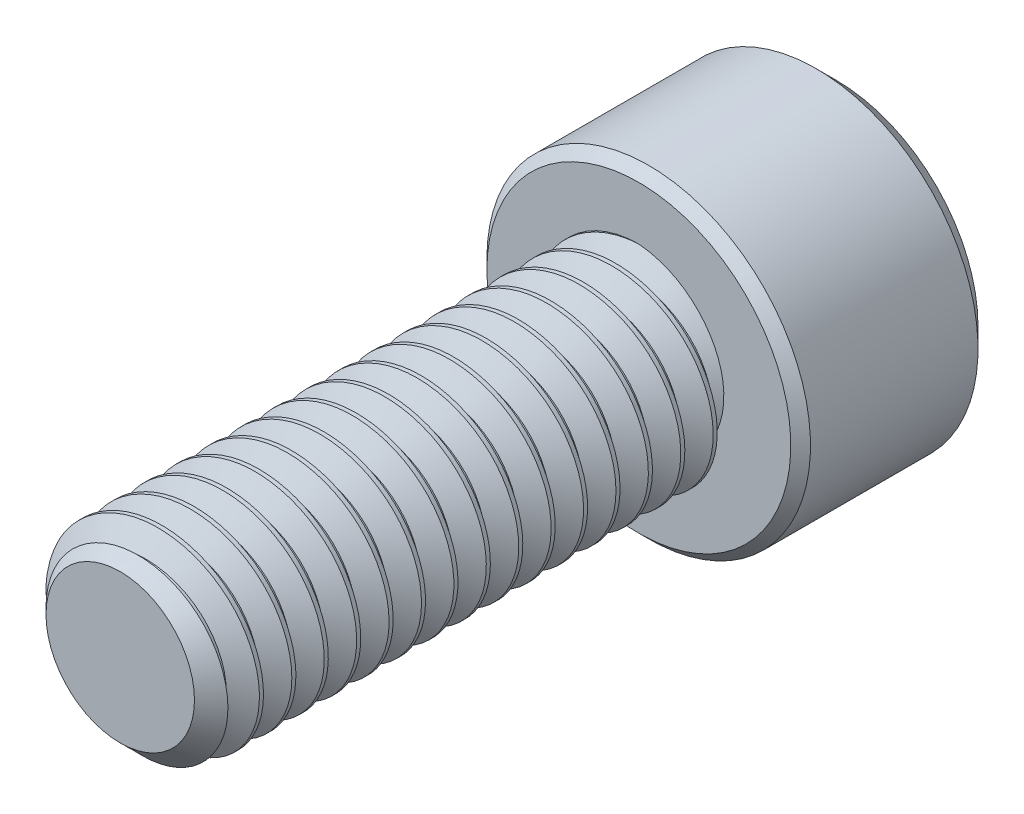
from build123d import *

# Parameters (mm, degrees)
SKETCH1_R          = 2.413
EXTRUDE1_DEPTH     = 12.7
CHAMFER3_SIZE      = 0.5953125
CUT_SWEEP1_PITCH   = 0.79375
SKETCH6_R          = 3.9624
EXTRUDE2_DEPTH     = 4.826
CUT_EXTRUDE1_DEPTH = 2.9765625
SKETCH8_R          = 2.291358881
CUT_EXTRUDE2_DEPTH = 0.4826
CUT_EXTRUDE2_DRAFT = -45
CHAMFER1_SIZE      = 0.4826
CHAMFER2_SIZE      = 0.2413


with BuildPart() as part:
    # Sketch1 → Extrude1 (new body)
    with BuildSketch(Plane.XY):
        Circle(SKETCH1_R)
    extrude(amount=-EXTRUDE1_DEPTH)

    # Chamfer3
    chamfer3_edges = [part.edges().sort_by_distance(p)[0] for p in [
        (-2.413, 0, 0),
    ]]
    chamfer(chamfer3_edges, length=CHAMFER3_SIZE)

    # Cut-Sweep1: the profile of Sketch3 profile screwed along a right-hand helix of 17 turns, 6 arcs to a turn; built about Z, then put on its axis
    cut_sweep1_z = Axis((0, 0, 0), (0, 0, 1))
    cut_sweep1_corners = [(2.4133, 0, -0.694704455), (1.897444252, 0, -0.396875), (1.897444252, 0, -0.29765625), (2.4133, 0, 0.000173205)]
    with BuildLine(mode=Mode.PRIVATE) as cut_sweep1_profile:
        Line(cut_sweep1_corners[0], cut_sweep1_corners[1])
        Line(cut_sweep1_corners[1], cut_sweep1_corners[2])
        Line(cut_sweep1_corners[2], cut_sweep1_corners[3])
        Line(cut_sweep1_corners[3], cut_sweep1_corners[0])
    cut_sweep1_cap = Face(cut_sweep1_profile.wire())
    cut_sweep1_turn_angles = [0, 30, 60, 90, 120, 150, 180, 210, 240, 270, 300, 330, 360]
    cut_sweep1_turn_weights = [1, 0.8660254037844387, 1, 0.8660254037844387, 1, 0.8660254037844387, 1, 0.8660254037844387, 1, 0.8660254037844387, 1, 0.8660254037844387, 1]
    cut_sweep1_turn_rails = [Edge.make_bspline([Vector(p[0], p[1], 0).rotate(cut_sweep1_z, cut_sweep1_turn_angles[k]) / cut_sweep1_turn_weights[k] + Vector(0, 0, p[2] + CUT_SWEEP1_PITCH * cut_sweep1_turn_angles[k] / 360) for k in range(13)], [0, 0, 0, 1, 1, 2, 2, 3, 3, 4, 4, 5, 5, 6, 6, 6], 2, cut_sweep1_turn_weights) for p in cut_sweep1_corners]
    cut_sweep1_turn_sides = [Face.make_surface_from_curves(cut_sweep1_turn_rails[p[0]], cut_sweep1_turn_rails[p[1]]) for p in [(0, 1), (1, 2), (2, 3), (3, 0)]]
    cut_sweep1 = Plane(origin=(0, 0, 0), x_dir=(0, 1, 0), z_dir=(0, 0, -1)) * Solid(Shell([*[p.moved(Location((0, 0, CUT_SWEEP1_PITCH * i))) for i in range(17) for p in cut_sweep1_turn_sides], cut_sweep1_cap, cut_sweep1_cap.rotate(cut_sweep1_z, 6120).moved(Location((0, 0, CUT_SWEEP1_PITCH * 6120 / 360)))]))
    add(cut_sweep1, mode=Mode.SUBTRACT)

    # Sketch6 → Extrude2 (add)
    with BuildSketch(Plane(origin=(0, 0, -12.7), x_dir=(-1, 0, 0), z_dir=(0, 0, -1))):
        Circle(SKETCH6_R)
    extrude(amount=EXTRUDE2_DEPTH)

    # Sketch7 → Cut-Extrude1 (cut)
    with BuildSketch(Plane(origin=(0, 0, -17.526), x_dir=(-1, 0, 0), z_dir=(0, 0, -1))):
        Polygon((0, 2.291358881), (-1.984375, 1.14567944), (-1.984375, -1.14567944), (0, -2.291358881), (1.984375, -1.14567944), (1.984375, 1.14567944), align=None)
    extrude(amount=-CUT_EXTRUDE1_DEPTH, mode=Mode.SUBTRACT)


with BuildPart() as cut_extrude2_tool:
    # Sketch8 → Cut-Extrude2 (with draft: the straight prism first)
    with BuildSketch(Plane(origin=(0, 0, -17.526), x_dir=(-1, 0, 0), z_dir=(0, 0, -1))):
        Circle(SKETCH8_R)
    extrude(amount=-CUT_EXTRUDE2_DEPTH)
    # Cut-Extrude2: the draft: its side faces are tilted about the plane it starts from
    cut_extrude2_sides = [cut_extrude2_tool.faces().sort_by_distance(p)[0] for p in [
        (2.291358881, 0, -17.2847),
    ]]
    draft(cut_extrude2_sides, Plane(origin=(0, 0, -17.526), x_dir=(-1, 0, 0), z_dir=(0, 0, -1)), CUT_EXTRUDE2_DRAFT)


with BuildPart() as part_1:
    add(part.part)

    # Cut-Extrude2: cut by cut_extrude2_tool
    add(cut_extrude2_tool.part, mode=Mode.SUBTRACT)

    # Chamfer1
    chamfer1_edges = [part_1.edges().sort_by_distance(p)[0] for p in [
        (3.9624, 0, -17.526),
    ]]
    chamfer(chamfer1_edges, length=CHAMFER1_SIZE)

    # Chamfer2
    chamfer2_edges = [part_1.edges().sort_by_distance(p)[0] for p in [
        (3.9624, 0, -12.7),
    ]]
    chamfer(chamfer2_edges, length=CHAMFER2_SIZE)


solid = part_1.part
